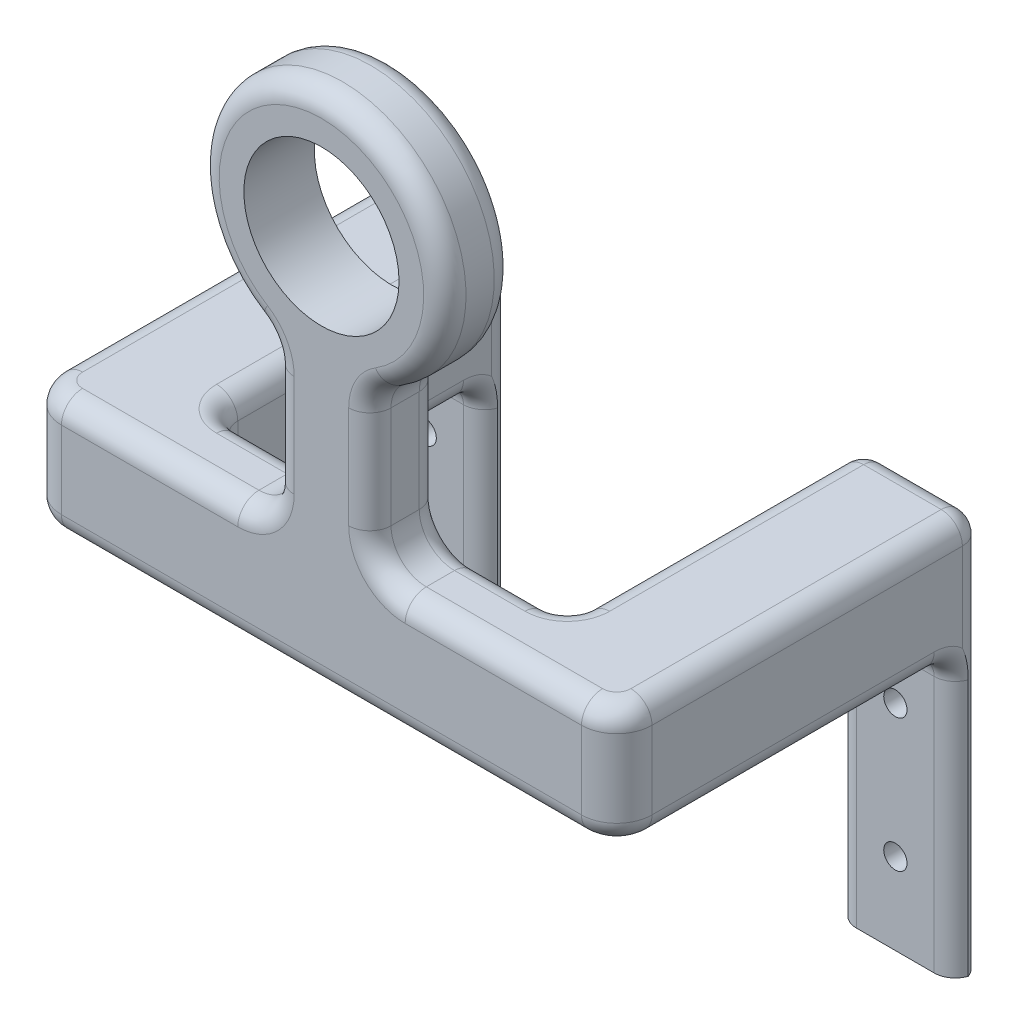
from build123d import *

# Parameters (mm, degrees)
CROQUIS5_R              = 17.5
CROQUIS5_R_2            = 11
SALIENTE_EXTRUIR4_DEPTH = 10
CROQUIS6_W              = 17
CROQUIS6_H              = 17
SALIENTE_EXTRUIR5_DEPTH = 10
REDONDEO2_R             = 5
CROQUIS6_4_W            = 17
CROQUIS6_4_H            = 17
SALIENTE_EXTRUIR6_DEPTH = 38
REDONDEO3_R             = 5
SALIENTE_EXTRUIR7_START = 38
CROQUIS6_5_W            = 17
CROQUIS6_5_H            = 56.408117822
CROQUIS6_5_R            = 1.65
SALIENTE_EXTRUIR7_DEPTH = 4
REDONDEO4_R             = 3
REDONDEO5_R             = 3
REDONDEO6_R             = 3
REDONDEO7_R             = 3


with BuildPart() as part:
    # Croquis5 → Saliente-Extruir4 (new body)
    with BuildSketch(Plane.XY):
        Circle(CROQUIS5_R)
        Circle(CROQUIS5_R_2, mode=Mode.SUBTRACT)
    extrude(amount=SALIENTE_EXTRUIR4_DEPTH)

    # Croquis6 → Saliente-Extruir5 (add)
    with BuildSketch(Plane(origin=(0, 0, 0), x_dir=(-1, 0, 0), z_dir=(0, 0, -1))):
        with BuildLine():
            ThreePointArc((6.86540329, -16.097087863), (0, -17.5), (-6.86540329, -16.097087863))
            Line((-6.86540329, -16.097087863), (-6.86540329, -38.591882178))
            Line((-6.86540329, -38.591882178), (-24.86540329, -38.591882178))
            Line((-24.86540329, -38.591882178), (-24.86540329, -55.591882178))
            Line((-24.86540329, -55.591882178), (24.86540329, -55.591882178))
            Line((24.86540329, -55.591882178), (24.86540329, -38.591882178))
            Line((24.86540329, -38.591882178), (6.86540329, -38.591882178))
            Line((6.86540329, -38.591882178), (6.86540329, -16.097087863))
        make_face()
        with Locations((-33.36540329, -47.091882178)):
            Rectangle(CROQUIS6_W, CROQUIS6_H)
        with Locations((33.36540329, -47.091882178)):
            Rectangle(CROQUIS6_W, CROQUIS6_H)
    extrude(amount=-SALIENTE_EXTRUIR5_DEPTH)

    # Redondeo2
    redondeo2_edges = [part.edges().sort_by_distance(p)[0] for p in [
        (-6.86540329, -16.097087863, 5),
        (-6.86540329, -38.591882178, 5),
        (6.86540329, -38.591882178, 5),
        (6.86540329, -16.097087863, 5),
    ]]
    fillet(redondeo2_edges, radius=REDONDEO2_R)

    # Croquis6<4> → Saliente-Extruir6 (add)
    with BuildSketch(Plane(origin=(0, 0, 0), x_dir=(-1, 0, 0), z_dir=(0, 0, -1))):
        with Locations((33.36540329, -47.091882178)):
            Rectangle(CROQUIS6_4_W, CROQUIS6_4_H)
        with Locations((-33.36540329, -47.091882178)):
            Rectangle(CROQUIS6_4_W, CROQUIS6_4_H)
    extrude(amount=SALIENTE_EXTRUIR6_DEPTH)

    # Redondeo3
    redondeo3_edges = [part.edges().sort_by_distance(p)[0] for p in [
        (41.86540329, -47.091882178, 10),
        (-41.86540329, -47.091882178, 10),
    ]]
    fillet(redondeo3_edges, radius=REDONDEO3_R)

    # Croquis6<5> → Saliente-Extruir7 (add)
    # profile 1 of 2: a face of its own
    with BuildSketch(Plane(origin=(0, 0, 0), x_dir=(-1, 0, 0), z_dir=(0, 0, -1)).offset(SALIENTE_EXTRUIR7_START)):
        with Locations((-33.36540329, -66.795941089)):
            Rectangle(CROQUIS6_5_W, CROQUIS6_5_H)
        with Locations((-33.36540329, -64.62222969)):
            Circle(CROQUIS6_5_R, mode=Mode.SUBTRACT)
        with Locations((-33.36540329, -83.464842185)):
            Circle(CROQUIS6_5_R, mode=Mode.SUBTRACT)
    # profile 2 of 2: a face of its own
    with BuildSketch(Plane(origin=(0, 0, 0), x_dir=(-1, 0, 0), z_dir=(0, 0, -1)).offset(SALIENTE_EXTRUIR7_START)):
        with Locations((33.36540329, -66.795941089)):
            Rectangle(CROQUIS6_5_W, CROQUIS6_5_H)
        with Locations((33.36540329, -64.62222969)):
            Circle(CROQUIS6_5_R, mode=Mode.SUBTRACT)
        with Locations((33.36540329, -83.464842185)):
            Circle(CROQUIS6_5_R, mode=Mode.SUBTRACT)
    extrude(amount=SALIENTE_EXTRUIR7_DEPTH)

    # Redondeo4
    redondeo4_edges = [part.edges().sort_by_distance(p)[0] for p in [
        (0, -55.591882178, 10),
        (-41.86540329, -55.591882178, -16.5),
        (-40.400937196, -55.591882178, 8.535533906),
        (40.400937196, -55.591882178, 8.535533906),
        (-41.86540329, -75.295941089, -38),
        (41.86540329, -75.295941089, -38),
        (-24.86540329, -47.091882178, 0),
        (-33.36540329, -55.591882178, -38),
        (33.36540329, -55.591882178, -38),
        (24.86540329, -47.091882178, 0),
        (41.86540329, -55.591882178, -16.5),
    ]]
    fillet(redondeo4_edges, radius=REDONDEO4_R)

    # Redondeo5
    redondeo5_edges = [part.edges().sort_by_distance(p)[0] for p in [
        (-33.36540329, -38.591882178, -42),
        (33.36540329, -38.591882178, -42),
    ]]
    fillet(redondeo5_edges, radius=REDONDEO5_R)

    # Redondeo6
    redondeo6_edges = [part.edges().sort_by_distance(p)[0] for p in [
        (-24.86540329, -76.795941089, -38),
        (24.86540329, -76.795941089, -38),
        (-24.86540329, -55.591882178, -19),
        (0, -55.591882178, 0),
        (24.86540329, -55.591882178, -19),
        (23.986723634, -55.591882178, -0.878679656),
        (-23.986723634, -55.591882178, -0.878679656),
        (24.86540329, -56.470561835, -37.121320344),
        (-24.86540329, -56.470561835, -37.121320344),
    ]]
    fillet(redondeo6_edges, radius=REDONDEO6_R)

    # Redondeo7
    # the kernel refuses this fillet: 3 mm, written as the material it takes off along each edge
    with BuildSketch(Plane(origin=(-24.86540329, -41.591882178, -42), x_dir=(0, 0, 1), z_dir=(0, -1, 0)), Plane(origin=(24.86540329, -102.5, -42), x_dir=(0, 0, 1), z_dir=(0, 1, 0)), Plane(origin=(41.86540329, -41.591882178, -42), x_dir=(0, 0, 1), z_dir=(0, -1, 0))) as redondeo7_piece_1:
        with BuildLine():
            CenterArc((REDONDEO7_R, REDONDEO7_R), REDONDEO7_R, 180, 90)
            Line((0, REDONDEO7_R), (0, 0))
            Line((0, 0), (REDONDEO7_R, 0))
        make_face()
    extrude(amount=60.908117822, mode=Mode.SUBTRACT)
    with BuildSketch(Plane(origin=(-24.86540329, -41.591882178, -39), x_dir=(0, 1, 0), z_dir=(0, 0, 1))) as redondeo7_piece_2:
        with BuildLine():
            CenterArc((3 - REDONDEO7_R, REDONDEO7_R), REDONDEO7_R, 270, 90)
            Line((3, REDONDEO7_R), (3, 0))
            Line((3, 0), (3 - REDONDEO7_R, 0))
        make_face()
    revolve(axis=Axis((-24.86540329, -41.591882178, -39), (-1, 0, 0)), revolution_arc=90, mode=Mode.SUBTRACT)
    with BuildSketch(Plane(origin=(-24.86540329, -38.591882178, -3), x_dir=(0, -1, 0), z_dir=(0, 0, -1))) as redondeo7_piece_3:
        with BuildLine():
            CenterArc((REDONDEO7_R, REDONDEO7_R), REDONDEO7_R, 180, 90)
            Line((0, REDONDEO7_R), (0, 0))
            Line((0, 0), (REDONDEO7_R, 0))
        make_face()
    extrude(amount=36, mode=Mode.SUBTRACT)
    with BuildSketch(Plane(origin=(-21.86540329, -38.591882178, -3), x_dir=(0, 0, 1), z_dir=(1, 0, 0))) as redondeo7_piece_4:
        with BuildLine():
            CenterArc((3 + REDONDEO7_R, REDONDEO7_R), REDONDEO7_R, 180, 90)
            Line((3 + REDONDEO7_R, 0), (3, 0))
            Line((3, 0), (3, REDONDEO7_R))
        make_face()
    revolve(axis=Axis((-21.86540329, -38.591882178, -3), (0, -1, 0)), revolution_arc=90, mode=Mode.SUBTRACT)
    with BuildSketch(Plane(origin=(-21.86540329, -38.591882178, 0), x_dir=(0, 0, 1), z_dir=(1, 0, 0))) as redondeo7_piece_5:
        with BuildLine():
            CenterArc((REDONDEO7_R, REDONDEO7_R), REDONDEO7_R, 180, 90)
            Line((0, REDONDEO7_R), (0, 0))
            Line((0, 0), (REDONDEO7_R, 0))
        make_face()
    extrude(amount=10, mode=Mode.SUBTRACT)
    with BuildSketch(Plane(origin=(-11.86540329, -33.591882178, 0), x_dir=(1, 0, 0), z_dir=(0, 1, 0))) as redondeo7_piece_6:
        with BuildLine():
            CenterArc((5 + REDONDEO7_R, -REDONDEO7_R), REDONDEO7_R, 90, 90)
            Line((5, -REDONDEO7_R), (5, 0))
            Line((5, 0), (5 + REDONDEO7_R, 0))
        make_face()
    revolve(axis=Axis((-11.86540329, -33.591882178, 0), (0, 0, -1)), revolution_arc=90, mode=Mode.SUBTRACT)
    with BuildSketch(Plane(origin=(-6.86540329, -33.591882178, 10), x_dir=(1, 0, 0), z_dir=(0, 1, 0)), Plane(origin=(6.86540329, -19.117065799, 10), x_dir=(-1, 0, 0), z_dir=(0, -1, 0))) as redondeo7_piece_7:
        with BuildLine():
            CenterArc((REDONDEO7_R, REDONDEO7_R), REDONDEO7_R, 180, 90)
            Line((0, REDONDEO7_R), (0, 0))
            Line((0, 0), (REDONDEO7_R, 0))
        make_face()
    extrude(amount=14.474816379, mode=Mode.SUBTRACT)
    with BuildSketch(Plane(origin=(-6.86540329, -33.591882178, 0), x_dir=(1, 0, 0), z_dir=(0, 1, 0)), Plane(origin=(6.86540329, -19.117065799, 0), x_dir=(-1, 0, 0), z_dir=(0, -1, 0))) as redondeo7_piece_8:
        with BuildLine():
            CenterArc((REDONDEO7_R, -REDONDEO7_R), REDONDEO7_R, 90, 90)
            Line((0, -REDONDEO7_R), (0, 0))
            Line((0, 0), (REDONDEO7_R, 0))
        make_face()
    extrude(amount=14.474816379, mode=Mode.SUBTRACT)
    with BuildSketch(Plane(origin=(-11.86540329, -19.117065799, 0), x_dir=(0.5273512573366691, 0.8496473688451193, 0), z_dir=(-0.8496473688451193, 0.5273512573366691, 0))) as redondeo7_piece_9:
        with BuildLine():
            CenterArc((5 + REDONDEO7_R, -REDONDEO7_R), REDONDEO7_R, 90, 90)
            Line((5, -REDONDEO7_R), (5, 0))
            Line((5, 0), (5 + REDONDEO7_R, 0))
        make_face()
    revolve(axis=Axis((-11.86540329, -19.117065799, 0), (0, 0, -1)), revolution_arc=58.17333597, mode=Mode.SUBTRACT)
    with BuildSketch(Plane(origin=(0, 0, 0), x_dir=(0.527351257336669, -0.8496473688451194, 0), z_dir=(-0.8496473688451194, -0.527351257336669, 0))) as redondeo7_piece_10:
        with BuildLine():
            CenterArc((17.5 - REDONDEO7_R, REDONDEO7_R), REDONDEO7_R, 270, 90)
            Line((17.5, REDONDEO7_R), (17.5, 0))
            Line((17.5, 0), (17.5 - REDONDEO7_R, 0))
        make_face()
    revolve(axis=Axis((0, 0, 0), (0, 0, 1)), revolution_arc=296.346671939, mode=Mode.SUBTRACT)
    with BuildSketch(Plane(origin=(11.86540329, -19.117065799, 0), x_dir=(-0.5273512573366712, 0.8496473688451178, 0), z_dir=(0.8496473688451178, 0.5273512573366712, 0))) as redondeo7_piece_11:
        with BuildLine():
            CenterArc((5 + REDONDEO7_R, REDONDEO7_R), REDONDEO7_R, 180, 90)
            Line((5, REDONDEO7_R), (5, 0))
            Line((5, 0), (5 + REDONDEO7_R, 0))
        make_face()
    revolve(axis=Axis((11.86540329, -19.117065799, 0), (0, 0, 1)), revolution_arc=58.17333597, mode=Mode.SUBTRACT)
    with BuildSketch(Plane(origin=(24.86540329, -41.591882178, -39), x_dir=(0, 1, 0), z_dir=(0, 0, 1))) as redondeo7_piece_12:
        with BuildLine():
            CenterArc((3 - REDONDEO7_R, -REDONDEO7_R), REDONDEO7_R, 0, 90)
            Line((3, -REDONDEO7_R), (3, 0))
            Line((3, 0), (3 - REDONDEO7_R, 0))
        make_face()
    revolve(axis=Axis((24.86540329, -41.591882178, -39), (-1, 0, 0)), revolution_arc=90, mode=Mode.SUBTRACT)
    with BuildSketch(Plane(origin=(24.86540329, -38.591882178, -39), x_dir=(1, 0, 0), z_dir=(0, 0, 1))) as redondeo7_piece_13:
        with BuildLine():
            CenterArc((REDONDEO7_R, -REDONDEO7_R), REDONDEO7_R, 90, 90)
            Line((0, -REDONDEO7_R), (0, 0))
            Line((0, 0), (REDONDEO7_R, 0))
        make_face()
    extrude(amount=36, mode=Mode.SUBTRACT)
    with BuildSketch(Plane(origin=(21.86540329, -38.591882178, -3), x_dir=(0, 0, 1), z_dir=(-1, 0, 0))) as redondeo7_piece_14:
        with BuildLine():
            CenterArc((3 + REDONDEO7_R, -REDONDEO7_R), REDONDEO7_R, 90, 90)
            Line((3 + REDONDEO7_R, 0), (3, 0))
            Line((3, 0), (3, -REDONDEO7_R))
        make_face()
    revolve(axis=Axis((21.86540329, -38.591882178, -3), (0, 1, 0)), revolution_arc=90, mode=Mode.SUBTRACT)
    with BuildSketch(Plane(origin=(11.86540329, -38.591882178, 0), x_dir=(0, -1, 0), z_dir=(1, 0, 0))) as redondeo7_piece_15:
        with BuildLine():
            CenterArc((REDONDEO7_R, -REDONDEO7_R), REDONDEO7_R, 90, 90)
            Line((0, -REDONDEO7_R), (0, 0))
            Line((0, 0), (REDONDEO7_R, 0))
        make_face()
    extrude(amount=10, mode=Mode.SUBTRACT)
    with BuildSketch(Plane(origin=(11.86540329, -33.591882178, 0), x_dir=(0, -1, 0), z_dir=(1, 0, 0))) as redondeo7_piece_16:
        with BuildLine():
            CenterArc((5 + REDONDEO7_R, -REDONDEO7_R), REDONDEO7_R, 90, 90)
            Line((5, -REDONDEO7_R), (5, 0))
            Line((5, 0), (5 + REDONDEO7_R, 0))
        make_face()
    revolve(axis=Axis((11.86540329, -33.591882178, 0), (0, 0, -1)), revolution_arc=90, mode=Mode.SUBTRACT)
    with BuildSketch(Plane(origin=(-41.86540329, -102.5, -42), x_dir=(1, 0, 0), z_dir=(0, 1, 0))) as redondeo7_piece_17:
        with BuildLine():
            CenterArc((REDONDEO7_R, -REDONDEO7_R), REDONDEO7_R, 90, 90)
            Line((0, -REDONDEO7_R), (0, 0))
            Line((0, 0), (REDONDEO7_R, 0))
        make_face()
    extrude(amount=60.908117822, mode=Mode.SUBTRACT)
    with BuildSketch(Plane(origin=(-41.86540329, -41.591882178, -39), x_dir=(0, 1, 0), z_dir=(0, 0, 1))) as redondeo7_piece_18:
        with BuildLine():
            CenterArc((3 - REDONDEO7_R, -REDONDEO7_R), REDONDEO7_R, 0, 90)
            Line((3 - REDONDEO7_R, 0), (3, 0))
            Line((3, 0), (3, -REDONDEO7_R))
        make_face()
    revolve(axis=Axis((-41.86540329, -41.591882178, -39), (-1, 0, 0)), revolution_arc=90, mode=Mode.SUBTRACT)
    with BuildSketch(Plane(origin=(-41.86540329, -38.591882178, -39), x_dir=(1, 0, 0), z_dir=(0, 0, 1)), Plane(origin=(41.86540329, -38.591882178, 5), x_dir=(-1, 0, 0), z_dir=(0, 0, -1))) as redondeo7_piece_19:
        with BuildLine():
            CenterArc((REDONDEO7_R, -REDONDEO7_R), REDONDEO7_R, 90, 90)
            Line((0, -REDONDEO7_R), (0, 0))
            Line((0, 0), (REDONDEO7_R, 0))
        make_face()
    extrude(amount=44, mode=Mode.SUBTRACT)
    with BuildSketch(Plane(origin=(-36.86540329, -38.591882178, 5), x_dir=(0, 0, 1), z_dir=(1, 0, 0))) as redondeo7_piece_20:
        with BuildLine():
            CenterArc((5 - REDONDEO7_R, REDONDEO7_R), REDONDEO7_R, 270, 90)
            Line((5, REDONDEO7_R), (5, 0))
            Line((5, 0), (5 - REDONDEO7_R, 0))
        make_face()
    revolve(axis=Axis((-36.86540329, -38.591882178, 5), (0, -1, 0)), revolution_arc=90, mode=Mode.SUBTRACT)
    with BuildSketch(Plane(origin=(-11.86540329, -33.591882178, 10), x_dir=(1, 0, 0), z_dir=(0, 1, 0))) as redondeo7_piece_21:
        with BuildLine():
            CenterArc((5 + REDONDEO7_R, REDONDEO7_R), REDONDEO7_R, 180, 90)
            Line((5 + REDONDEO7_R, 0), (5, 0))
            Line((5, 0), (5, REDONDEO7_R))
        make_face()
    revolve(axis=Axis((-11.86540329, -33.591882178, 10), (0, 0, -1)), revolution_arc=90, mode=Mode.SUBTRACT)
    with BuildSketch(Plane(origin=(-11.86540329, -19.117065799, 10), x_dir=(0.5273512573366684, 0.8496473688451196, 0), z_dir=(-0.8496473688451196, 0.5273512573366684, 0))) as redondeo7_piece_22:
        with BuildLine():
            CenterArc((5 + REDONDEO7_R, REDONDEO7_R), REDONDEO7_R, 180, 90)
            Line((5, REDONDEO7_R), (5, 0))
            Line((5, 0), (5 + REDONDEO7_R, 0))
        make_face()
    revolve(axis=Axis((-11.86540329, -19.117065799, 10), (0, 0, -1)), revolution_arc=58.17333597, mode=Mode.SUBTRACT)
    with BuildSketch(Plane(origin=(0, 0, 10), x_dir=(-0.5273512573366697, -0.8496473688451189, 0), z_dir=(0.8496473688451189, -0.5273512573366697, 0))) as redondeo7_piece_23:
        with BuildLine():
            CenterArc((17.5 - REDONDEO7_R, REDONDEO7_R), REDONDEO7_R, 270, 90)
            Line((17.5, REDONDEO7_R), (17.5, 0))
            Line((17.5, 0), (17.5 - REDONDEO7_R, 0))
        make_face()
    revolve(axis=Axis((0, 0, 10), (0, 0, -1)), revolution_arc=296.346671939, mode=Mode.SUBTRACT)
    with BuildSketch(Plane(origin=(11.86540329, -19.117065799, 10), x_dir=(-0.5273512573366712, 0.8496473688451178, 0), z_dir=(0.8496473688451178, 0.5273512573366712, 0))) as redondeo7_piece_24:
        with BuildLine():
            CenterArc((5 + REDONDEO7_R, -REDONDEO7_R), REDONDEO7_R, 90, 90)
            Line((5, -REDONDEO7_R), (5, 0))
            Line((5, 0), (5 + REDONDEO7_R, 0))
        make_face()
    revolve(axis=Axis((11.86540329, -19.117065799, 10), (0, 0, 1)), revolution_arc=58.17333597, mode=Mode.SUBTRACT)
    with BuildSketch(Plane(origin=(11.86540329, -33.591882178, 10), x_dir=(0, -1, 0), z_dir=(1, 0, 0))) as redondeo7_piece_25:
        with BuildLine():
            CenterArc((5 + REDONDEO7_R, REDONDEO7_R), REDONDEO7_R, 180, 90)
            Line((5, REDONDEO7_R), (5, 0))
            Line((5, 0), (5 + REDONDEO7_R, 0))
        make_face()
    revolve(axis=Axis((11.86540329, -33.591882178, 10), (0, 0, -1)), revolution_arc=90, mode=Mode.SUBTRACT)
    with BuildSketch(Plane(origin=(41.86540329, -41.591882178, -39), x_dir=(0, 1, 0), z_dir=(0, 0, 1))) as redondeo7_piece_26:
        with BuildLine():
            CenterArc((3 - REDONDEO7_R, REDONDEO7_R), REDONDEO7_R, 270, 90)
            Line((3 - REDONDEO7_R, 0), (3, 0))
            Line((3, 0), (3, REDONDEO7_R))
        make_face()
    revolve(axis=Axis((41.86540329, -41.591882178, -39), (-1, 0, 0)), revolution_arc=90, mode=Mode.SUBTRACT)
    with BuildSketch(Plane(origin=(36.86540329, -38.591882178, 5), x_dir=(0, 0, 1), z_dir=(-1, 0, 0))) as redondeo7_piece_27:
        with BuildLine():
            CenterArc((5 - REDONDEO7_R, -REDONDEO7_R), REDONDEO7_R, 0, 90)
            Line((5, -REDONDEO7_R), (5, 0))
            Line((5, 0), (5 - REDONDEO7_R, 0))
        make_face()
    revolve(axis=Axis((36.86540329, -38.591882178, 5), (0, 1, 0)), revolution_arc=90, mode=Mode.SUBTRACT)
    with BuildSketch(Plane(origin=(-11.86540329, -38.591882178, 10), x_dir=(0, 0, -1), z_dir=(-1, 0, 0))) as redondeo7_piece_28:
        with BuildLine():
            CenterArc((REDONDEO7_R, REDONDEO7_R), REDONDEO7_R, 180, 90)
            Line((0, REDONDEO7_R), (0, 0))
            Line((0, 0), (REDONDEO7_R, 0))
        make_face()
    extrude(amount=25, mode=Mode.SUBTRACT)
    with BuildSketch(Plane(origin=(36.86540329, -38.591882178, 10), x_dir=(0, -1, 0), z_dir=(-1, 0, 0))) as redondeo7_piece_29:
        with BuildLine():
            CenterArc((REDONDEO7_R, -REDONDEO7_R), REDONDEO7_R, 90, 90)
            Line((0, -REDONDEO7_R), (0, 0))
            Line((0, 0), (REDONDEO7_R, 0))
        make_face()
    extrude(amount=25, mode=Mode.SUBTRACT)


solid = part.part
